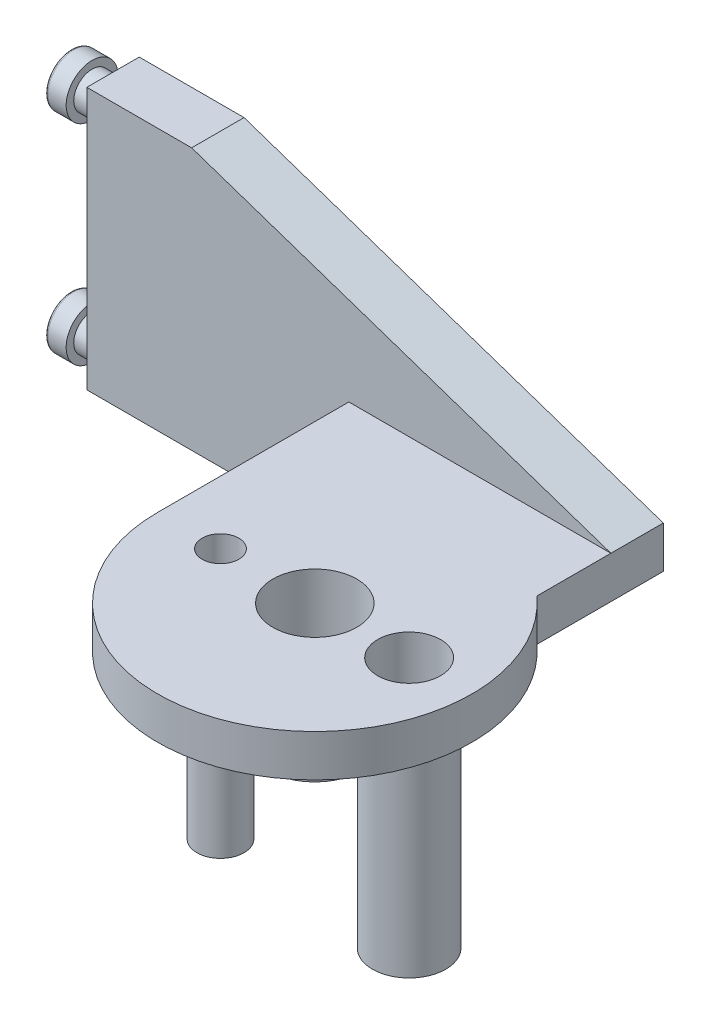
from build123d import *

# Parameters (mm, degrees)
SKETCH3_W               = 100
SKETCH3_H               = 50
BOSS_EXTRUDE1_DEPTH     = 10
SKETCH4_R               = 3.5
BOSS_EXTRUDE2_DEPTH     = 4
SKETCH5_R               = 4.95
BOSS_EXTRUDE3_DEPTH     = 4
BOSS_EXTRUDE4_DEPTH     = 50
CUT_EXTRUDE1_DEPTH      = 110.326346321
CUT_EXTRUDE1_DEPTH_BACK = 110.326346321
SKETCH7_R               = 8
CUT_EXTRUDE2_DEPTH      = 101.385506922
CUT_EXTRUDE2_DEPTH_BACK = 101.385506922
SKETCH10_W              = 66.5
SKETCH10_H              = 27
CUT_EXTRUDE3_DEPTH      = 93.990590922
SKETCH12_W              = 66.5
SKETCH12_H              = 15
CUT_EXTRUDE4_DEPTH      = 101.385506922
CUT_EXTRUDE5_DEPTH      = 93.990590922
SKETCH15_R              = 3.5
SKETCH15_R_2            = 6
CUT_EXTRUDE6_DEPTH      = 101.902180353
SKETCH16_R              = 4.5
SKETCH16_R_2            = 7
BOSS_EXTRUDE5_DEPTH     = 40
SKETCH17_R              = 6
SKETCH17_R_2            = 3.5
CUT_EXTRUDE7_DEPTH      = 106.129681822
SKETCH18_R              = 9.25
BOSS_EXTRUDE6_DEPTH     = 15
SKETCH19_R              = 8
CUT_EXTRUDE8_DEPTH      = 110.326346321
FILLET3_R               = 2
FILLET4_R               = 0.5


with BuildPart() as part:
    # Sketch3 → Boss-Extrude1 (new body)
    with BuildSketch(Plane.XY):
        Rectangle(SKETCH3_W, SKETCH3_H)
    extrude(amount=BOSS_EXTRUDE1_DEPTH)

    # Sketch4 → Boss-Extrude2 (add)
    with BuildSketch(Plane.ZY.offset(50)):
        with Locations(Location((5, 20, 0), (0, 0, 180))):
            Circle(SKETCH4_R)
        with Locations(Location((5, -20, 0), (0, 0, 180))):
            Circle(SKETCH4_R)
    extrude(amount=BOSS_EXTRUDE2_DEPTH)

    # Sketch5 → Boss-Extrude3 (add)
    with BuildSketch(Plane.ZY.offset(54)):
        with Locations((5, 20)):
            Circle(SKETCH5_R)
        with Locations((5, -20)):
            Circle(SKETCH5_R)
    extrude(amount=BOSS_EXTRUDE3_DEPTH)

    # Sketch6 → Boss-Extrude4 (add)
    with BuildSketch(Plane(origin=(0, 25, 0), x_dir=(1, 0, 0), z_dir=(0, 1, 0))):
        with BuildLine():
            Line((0, -46.5), (0, -10))
            Line((0, -10), (50, -10))
            Line((50, -10), (50, -24.139320225))
            ThreePointArc((50, -24.139320225), (42.247448714, -73.886127875), (0, -46.5))
        make_face()
    extrude(amount=-BOSS_EXTRUDE4_DEPTH)

    # Sketch7 → Cut-Extrude1 (cut, two sides: drawn at the far end of the back side and taken through both)
    with BuildSketch(Plane(origin=(0, 25, 0), x_dir=(1, 0, 0), z_dir=(0, 1, 0)).offset(-CUT_EXTRUDE1_DEPTH_BACK)):
        with Locations(Location((30, -46.5, 0), (0, 0, 270))):
            Circle(SKETCH7_R)
    extrude(amount=CUT_EXTRUDE1_DEPTH + CUT_EXTRUDE1_DEPTH_BACK, mode=Mode.SUBTRACT)

    # Sketch10 → Cut-Extrude2 (cut, two sides: drawn at the far end of the back side and taken through both)
    with BuildSketch(Plane.ZY.offset(-CUT_EXTRUDE2_DEPTH_BACK)):
        with Locations((43.25, 11.5)):
            Rectangle(SKETCH10_W, SKETCH10_H)
    extrude(amount=CUT_EXTRUDE2_DEPTH + CUT_EXTRUDE2_DEPTH_BACK, mode=Mode.SUBTRACT)

    # Sketch11 → Cut-Extrude3 (cut, through all)
    with BuildSketch(Plane.XY.offset(10)):
        Polygon((50, -2), (-30, 25), (50, 25), align=None)
    extrude(amount=-CUT_EXTRUDE3_DEPTH, mode=Mode.SUBTRACT)

    # Sketch12 → Cut-Extrude4 (cut, through all)
    with BuildSketch(Plane.ZY):
        with Locations((43.25, -17.5)):
            Rectangle(SKETCH12_W, SKETCH12_H)
    extrude(amount=-CUT_EXTRUDE4_DEPTH, mode=Mode.SUBTRACT)

    # Sketch13 → Cut-Extrude5 (cut, through all)
    with BuildSketch(Plane.XY.offset(10)):
        Polygon((50, -10), (-18, -25), (50, -25), align=None)
    extrude(amount=-CUT_EXTRUDE5_DEPTH, mode=Mode.SUBTRACT)

    # Sketch15 → Cut-Extrude6 (cut, through all)
    with BuildSketch(Plane(origin=(0, -2, 0), x_dir=(1, 0, 0), z_dir=(0, 1, 0))):
        with Locations(Location((12, -46.5, 0), (0, 0, 270))):
            Circle(SKETCH15_R)
        with Locations(Location((48, -46.5, 0), (0, 0, 270))):
            Circle(SKETCH15_R_2)
    extrude(amount=-CUT_EXTRUDE6_DEPTH, mode=Mode.SUBTRACT)

    # Sketch16 → Boss-Extrude5 (add)
    with BuildSketch(Plane(origin=(0, -10, 0), x_dir=(-1, 0, 0), z_dir=(0, -1, 0))):
        with Locations(Location((-12, -46.5, 0), (0, 0, 270))):
            Circle(SKETCH16_R)
        with Locations(Location((-48, -46.5, 0), (0, 0, 270))):
            Circle(SKETCH16_R_2)
    extrude(amount=BOSS_EXTRUDE5_DEPTH)

    # Sketch17 → Cut-Extrude7 (cut, through all)
    with BuildSketch(Plane(origin=(0, -10, 0), x_dir=(1, 0, 0), z_dir=(0, 1, 0))):
        with Locations(Location((48, -46.5, 0), (0, 0, 270))):
            Circle(SKETCH17_R)
        with Locations(Location((12, -46.5, 0), (0, 0, 270))):
            Circle(SKETCH17_R_2)
    extrude(amount=-CUT_EXTRUDE7_DEPTH, mode=Mode.SUBTRACT)

    # Sketch18 → Boss-Extrude6 (add)
    with BuildSketch(Plane.XZ.offset(10)):
        with Locations(Location((30, 46.5, 0), (0, 0, 90))):
            Circle(SKETCH18_R)
    extrude(amount=BOSS_EXTRUDE6_DEPTH)

    # Sketch19 → Cut-Extrude8 (cut, through all)
    with BuildSketch(Plane.XZ.offset(25)):
        with Locations(Location((30, 46.5, 0), (0, 0, 270))):
            Circle(SKETCH19_R)
    extrude(amount=-CUT_EXTRUDE8_DEPTH, mode=Mode.SUBTRACT)

    # Fillet3
    # the kernel refuses this fillet: 2 mm, written as the material it adds along each edge
    with BuildSketch(Plane(origin=(48, -10, 46.5), x_dir=(0, 0, 1), z_dir=(1, 0, 0))) as fillet3_piece_1:
        with BuildLine():
            CenterArc((7 + FILLET3_R, FILLET3_R), FILLET3_R, 180, 90)
            Line((7 + FILLET3_R, 0), (7, 0))
            Line((7, 0), (7, FILLET3_R))
        make_face()
    revolve(axis=Axis((48, -10, 46.5), (0, -1, 0)))
    with BuildSketch(Plane(origin=(12, -10, 46.5), x_dir=(0, 0, 1), z_dir=(1, 0, 0))) as fillet3_piece_2:
        with BuildLine():
            CenterArc((4.5 + FILLET3_R, FILLET3_R), FILLET3_R, 180, 90)
            Line((4.5 + FILLET3_R, 0), (4.5, 0))
            Line((4.5, 0), (4.5, FILLET3_R))
        make_face()
    revolve(axis=Axis((12, -10, 46.5), (0, -1, 0)))
    with BuildSketch(Plane(origin=(30, -10, 46.5), x_dir=(0, 0, 1), z_dir=(1, 0, 0))) as fillet3_piece_3:
        with BuildLine():
            CenterArc((9.25 + FILLET3_R, FILLET3_R), FILLET3_R, 180, 90)
            Line((9.25 + FILLET3_R, 0), (9.25, 0))
            Line((9.25, 0), (9.25, FILLET3_R))
        make_face()
    revolve(axis=Axis((30, -10, 46.5), (0, -1, 0)))

    # Fillet4
    fillet4_edges = [part.edges().sort_by_distance(p)[0] for p in [
        (-58, 20, 0.05),
        (-58, -20, 0.05),
    ]]
    fillet(fillet4_edges, radius=FILLET4_R)


solid = part.part
